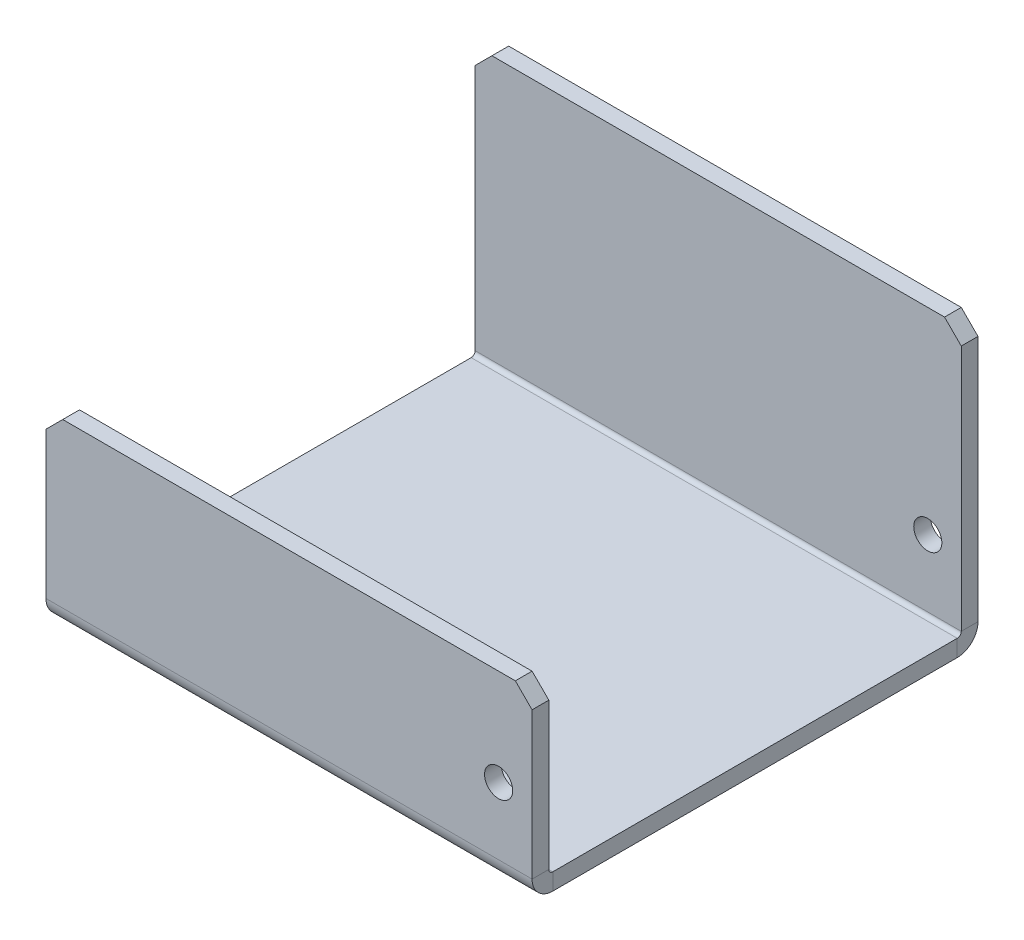
from build123d import *

# Parameters (mm, degrees)
SKETCH1_W            = 92.202
SKETCH1_H            = 78.232
BOSS_EXTRUDE1_DEPTH  = 3.175
EDGE_FLANGE1_DEPTH   = 92.202
EDGE_FLANGE1_2_DEPTH = 92.202
EDGE_FLANGE2_DEPTH   = 92.202
EDGE_FLANGE2_2_DEPTH = 92.202
SKETCH9_R            = 2.667
CUT_EXTRUDE1_DEPTH   = 137.266738983
CHAMFER1_SIZE        = 3.175


# Read off the part's stored shape, not the designer's step: Edge-Flange1, Edge-Flange2
with BuildPart() as part:
    # Sketch1 → Boss-Extrude1 (new body)
    with BuildSketch(Plane(origin=(0, 0, 0), x_dir=(1, 0, 0), z_dir=(0, 1, 0))):
        with Locations((46.101, 39.116)):
            Rectangle(SKETCH1_W, SKETCH1_H)
    extrude(amount=BOSS_EXTRUDE1_DEPTH)

    # Edge-Flange1 outline → Edge-Flange1 (cut)
    with BuildSketch(Plane.YZ):
        with BuildLine():
            Line((0, -78.232), (0.074445793, -78.232))
            ThreePointArc((0.074445793, -78.232), (0.018655648, -77.852813981), (0, -77.47))
            Line((0, -77.47), (0, -78.232))
        make_face()
    extrude(amount=EDGE_FLANGE1_DEPTH, mode=Mode.SUBTRACT)

    # Edge-Flange1 2 outline → Edge-Flange1 2 (add)
    with BuildSketch(Plane.YZ):
        with BuildLine():
            ThreePointArc((0.074445793, -78.232), (1.4370025, -80.511378224), (3.937, -81.407))
            Line((3.937, -81.407), (53.975, -81.407))
            Line((53.975, -81.407), (53.975, -78.232))
            Line((53.975, -78.232), (3.937, -78.232))
            ThreePointArc((3.937, -78.232), (3.398184633, -78.008815367), (3.175, -77.47))
            Line((3.175, -77.47), (3.175, -78.232))
            Line((3.175, -78.232), (0.074445793, -78.232))
        make_face()
    extrude(amount=EDGE_FLANGE1_2_DEPTH)

    # Edge-Flange2 outline → Edge-Flange2 (cut)
    with BuildSketch(Plane.YZ):
        with BuildLine():
            ThreePointArc((0, -0.762), (0.018655648, -0.379186019), (0.074445793, 0))
            Line((0.074445793, 0), (0, 0))
            Line((0, 0), (0, -0.762))
        make_face()
    extrude(amount=EDGE_FLANGE2_DEPTH, mode=Mode.SUBTRACT)

    # Edge-Flange2 2 outline → Edge-Flange2 2 (add)
    with BuildSketch(Plane.YZ):
        with BuildLine():
            Line((34.925, 3.175), (3.937, 3.175))
            ThreePointArc((3.937, 3.175), (1.4370025, 2.279378224), (0.074445793, 0))
            Line((0.074445793, 0), (3.175, 0))
            Line((3.175, 0), (3.175, -0.762))
            ThreePointArc((3.175, -0.762), (3.398184633, -0.223184633), (3.937, 0))
            Line((3.937, 0), (34.925, 0))
            Line((34.925, 0), (34.925, 3.175))
        make_face()
    extrude(amount=EDGE_FLANGE2_2_DEPTH)

    # Sketch9 → Cut-Extrude1 (cut, through all)
    with BuildSketch(Plane.XY.offset(3.175)):
        with Locations((85.852, 16.637)):
            Circle(SKETCH9_R)
    extrude(amount=-CUT_EXTRUDE1_DEPTH, mode=Mode.SUBTRACT)

    # Chamfer1
    chamfer1_edges = [part.edges().sort_by_distance(p)[0] for p in [
        (92.202, 53.975, -79.8195),
        (0, 53.975, -79.8195),
        (0, 34.925, 1.5875),
        (92.202, 34.925, 1.5875),
    ]]
    chamfer(chamfer1_edges, length=CHAMFER1_SIZE)


solid = part.part
